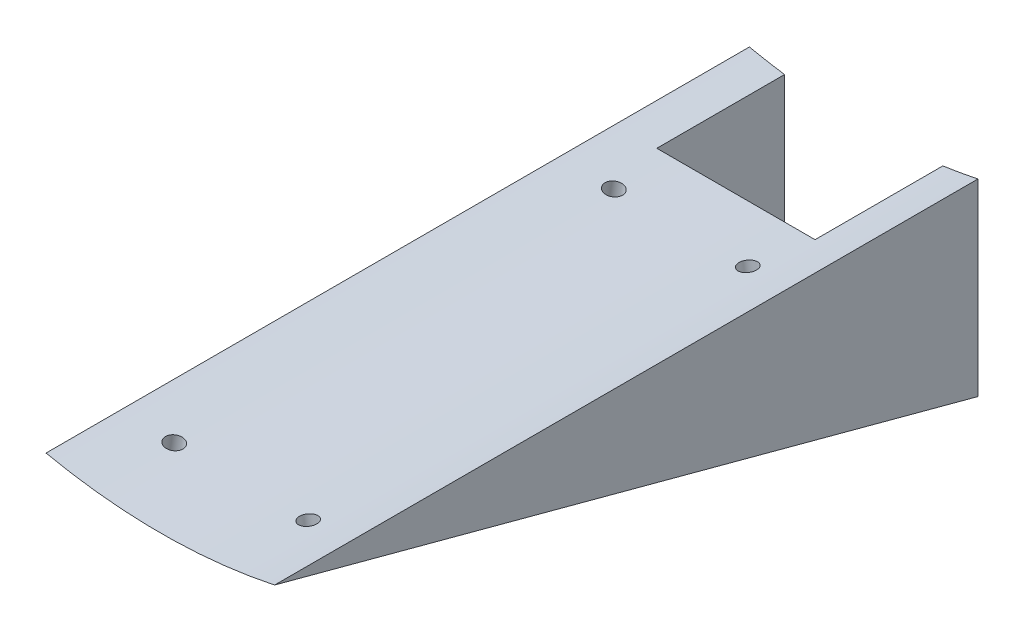
from build123d import *
from build123d.topology import SkipClean

# Parameters (mm, degrees)
BOSS_EXTRUDE1_DEPTH     = 27
BOSS_EXTRUDE2_DEPTH     = 65
CUT_EXTRUDE1_DEPTH      = 91.890043459
FILLET1_R               = 1
BOSS_EXTRUDE3_REACH     = 104.243
CUT_EXTRUDE2_REACH      = 104.243
BOSS_EXTRUDE4_REACH     = 92.026
BOSS_EXTRUDE5_DEPTH     = 65
SKETCH14_R              = 1.5
CUT_EXTRUDE7_DEPTH      = 5
CUT_EXTRUDE9_DEPTH      = 105.630301538
CUT_EXTRUDE9_DEPTH_BACK = 105.630301538
SKETCH15_W              = 45
SKETCH15_H              = 5.74
SKETCH16_R              = 1.5
CUT_EXTRUDE10_DEPTH     = 10
FILLET4_R               = 23
BOSS_EXTRUDE7_REACH     = 219.626
CUT_EXTRUDE5_DEPTH      = 184.620949427
CUT_EXTRUDE5_DEPTH_BACK = 184.620949427
SKETCH11_R              = 2.5
CUT_EXTRUDE6_DEPTH      = 186.847147779
CUT_EXTRUDE6_DEPTH_BACK = 186.847147779
SKETCH12_R              = 2.5
CUT_SWEEP1_START        = -43.471641414
CUT_SWEEP1_DEPTH        = 207.679031883


# Read off the part's stored shape, not the designer's step: Cut-Sweep1
with BuildPart() as part:
    # Sketch1 → Boss-Extrude1 (new body)
    with BuildSketch(Plane.XY):
        with BuildLine():
            Line((0, 0), (0, -26))
            ThreePointArc((0, -26), (32.5, -29.41402025), (65, -26))
            Line((65, -26), (65, 0))
            ThreePointArc((65, 0), (32.5, -3.41402025), (0, 0))
        make_face()
    extrude(amount=BOSS_EXTRUDE1_DEPTH)

    # Sketch4 → Boss-Extrude2 (add)
    with BuildSketch(Plane(origin=(65, 0, 0), x_dir=(0, 0, -1), z_dir=(1, 0, 0))):
        Polygon((0, -26), (30, -56), (30, -30), (0, 0), align=None)
    extrude(amount=-BOSS_EXTRUDE2_DEPTH)

    # Sketch5 → Cut-Extrude1 (cut, through all)
    with BuildSketch(Plane.XY):
        with BuildLine():
            Line((65, 0), (0, 0))
            ThreePointArc((0, 0), (32.5, -3.41402025), (65, 0))
        make_face()
    extrude(amount=-CUT_EXTRUDE1_DEPTH, mode=Mode.SUBTRACT)

    # Fillet1
    fillet1_edges = [part.edges().sort_by_distance(p)[0] for p in [
        (32.5, -56, -30),
    ]]
    fillet(fillet1_edges, radius=FILLET1_R)

    # Boss-Extrude3: up to this face of the body (flat: up to its plane)
    boss_extrude3_end = Plane(part.part.faces().sort_by_distance((32.5, -41.792893219, -30))[0])
    # Sketch6 → Boss-Extrude3 (add, up to the picked face)
    with BuildSketch(Plane.XY.offset(27), mode=Mode.PRIVATE) as boss_extrude3_sk1:
        with BuildLine():
            ThreePointArc((0, -26), (4.985486693, -26.974767058), (10, -27.787112227))
            Line((10, -27.787112227), (10, -1.787112227))
            ThreePointArc((10, -1.787112227), (4.985486693, -0.974767058), (0, 0))
            Line((0, 0), (0, -26))
        make_face()
    boss_extrude3_tool1 = split(extrude(boss_extrude3_sk1.sketch, amount=-BOSS_EXTRUDE3_REACH, mode=Mode.PRIVATE), bisect_by=boss_extrude3_end, keep=Keep.BOTH, mode=Mode.PRIVATE)
    # Sketch6 → Boss-Extrude3 (add, up to the picked face)
    with BuildSketch(Plane.XY.offset(27), mode=Mode.PRIVATE) as boss_extrude3_sk2:
        with BuildLine():
            Line((55, -1.787112227), (55, -27.787112227))
            ThreePointArc((55, -27.787112227), (60.014513307, -26.974767058), (65, -26))
            Line((65, -26), (65, 0))
            ThreePointArc((65, 0), (60.014513307, -0.974767058), (55, -1.787112227))
        make_face()
    boss_extrude3_tool2 = split(extrude(boss_extrude3_sk2.sketch, amount=-BOSS_EXTRUDE3_REACH, mode=Mode.PRIVATE), bisect_by=boss_extrude3_end, keep=Keep.BOTH, mode=Mode.PRIVATE)
    # Sketch6 → Boss-Extrude3 (add, up to the picked face)
    with BuildSketch(Plane.XY.offset(27), mode=Mode.PRIVATE) as boss_extrude3_sk3:
        with BuildLine():
            Line((10, -54.292893219), (10, -27.787112227))
            ThreePointArc((10, -27.787112227), (4.985486693, -26.974767058), (0, -26))
            Line((0, -26), (0, -54.292893219))
            Line((0, -54.292893219), (10, -54.292893219))
        make_face()
    boss_extrude3_tool3 = split(extrude(boss_extrude3_sk3.sketch, amount=-BOSS_EXTRUDE3_REACH, mode=Mode.PRIVATE), bisect_by=boss_extrude3_end, keep=Keep.BOTH, mode=Mode.PRIVATE)
    # Sketch6 → Boss-Extrude3 (add, up to the picked face)
    with BuildSketch(Plane.XY.offset(27), mode=Mode.PRIVATE) as boss_extrude3_sk4:
        with BuildLine():
            ThreePointArc((65, -26), (60.014513307, -26.974767058), (55, -27.787112227))
            Line((55, -27.787112227), (55, -54.292893219))
            Line((55, -54.292893219), (65, -54.292893219))
            Line((65, -54.292893219), (65, -26))
        make_face()
    boss_extrude3_tool4 = split(extrude(boss_extrude3_sk4.sketch, amount=-BOSS_EXTRUDE3_REACH, mode=Mode.PRIVATE), bisect_by=boss_extrude3_end, keep=Keep.BOTH, mode=Mode.PRIVATE)
    add(boss_extrude3_tool1.solids().sort_by(Axis((5, -13.949429, 27), (0, 0, -1)))[0])
    add(boss_extrude3_tool2.solids().sort_by(Axis((60, -13.949429, 27), (0, 0, -1)))[0])
    add(boss_extrude3_tool3.solids().sort_by(Axis((4.945547, -40.616285, 27), (0, 0, -1)))[0])
    add(boss_extrude3_tool4.solids().sort_by(Axis((60.054453, -40.616285, 27), (0, 0, -1)))[0])

    # Cut-Extrude2: up to this plane
    cut_extrude2_end = Plane(origin=(-63.529520697, -13, 13), z_dir=(0, -0.7071067811865562, 0.7071067811865389))
    # Sketch7 → Cut-Extrude2 (cut, up to the surface)
    with BuildSketch(Plane.XY.offset(27), mode=Mode.PRIVATE) as cut_extrude2_sk1:
        with BuildLine():
            ThreePointArc((10, -27.787112227), (4.985486693, -26.974767058), (0, -26))
            Line((0, -26), (0, -54.292893219))
            Line((0, -54.292893219), (10, -54.292893219))
            Line((10, -54.292893219), (10, -27.787112227))
        make_face()
    cut_extrude2_tool1 = split(extrude(cut_extrude2_sk1.sketch, amount=-CUT_EXTRUDE2_REACH, mode=Mode.PRIVATE), bisect_by=cut_extrude2_end, keep=Keep.BOTH, mode=Mode.PRIVATE)
    add(cut_extrude2_tool1.solids().sort_by_distance((4.945547, -40.616285, 27))[0], mode=Mode.SUBTRACT)
    # Sketch7 → Cut-Extrude2 (cut, up to the surface)
    with BuildSketch(Plane.XY.offset(27), mode=Mode.PRIVATE) as cut_extrude2_sk2:
        with BuildLine():
            Line((65, -54.292893219), (65, -26))
            ThreePointArc((65, -26), (60.014513307, -26.974767058), (55, -27.787112227))
            Line((55, -27.787112227), (55, -54.292893219))
            Line((55, -54.292893219), (65, -54.292893219))
        make_face()
    cut_extrude2_tool2 = split(extrude(cut_extrude2_sk2.sketch, amount=-CUT_EXTRUDE2_REACH, mode=Mode.PRIVATE), bisect_by=cut_extrude2_end, keep=Keep.BOTH, mode=Mode.PRIVATE)
    add(cut_extrude2_tool2.solids().sort_by_distance((60.054453, -40.616285, 27))[0], mode=Mode.SUBTRACT)

    # Boss-Extrude4: up to this face of the body (flat: up to its plane)
    boss_extrude4_end = Plane(part.part.faces().sort_by_distance((32.5, -40.28761869, -14.28761869))[0])
    # Sketch8 → Boss-Extrude4 (add, up to the picked face)
    with BuildSketch(Plane(origin=(0, 0, 0), x_dir=(-1, 0, 0), z_dir=(0, 0, -1)), mode=Mode.PRIVATE) as boss_extrude4_sk1:
        with BuildLine():
            Line((-55, -26), (-55, -27.787112227))
            ThreePointArc((-55, -27.787112227), (-32.5, -29.41402025), (-10, -27.787112227))
            Line((-10, -27.787112227), (-10, -26))
            Line((-10, -26), (-55, -26))
        make_face()
    boss_extrude4_tool1 = split(extrude(boss_extrude4_sk1.sketch, amount=BOSS_EXTRUDE4_REACH, mode=Mode.PRIVATE), bisect_by=boss_extrude4_end, keep=Keep.BOTH, mode=Mode.PRIVATE)
    add(boss_extrude4_tool1.solids().sort_by(Axis((32.5, -27.477312, 0), (0, 0, -1)))[0])

    # Sketch9 → Boss-Extrude5 (add)
    with BuildSketch(Plane.ZY):
        Polygon((-30, -51), (-25, -51), (-30, -56), align=None)
    extrude(amount=-BOSS_EXTRUDE5_DEPTH)

    # Sketch14 → Cut-Extrude7 (cut)
    with SkipClean():  # the faces are left unmerged after this step: merging them gives an invalid solid
        with BuildSketch(Plane(origin=(0, 0, 0), x_dir=(1, 0, 0), z_dir=(0, 0.7071067811865561, -0.7071067811865389))):
            with Locations(Location((14, 35.887280306, 0), (0, 0, 270))):
                Circle(SKETCH14_R)
            with Locations(Location((51, 35.887280306, 0), (0, 0, 270))):
                Circle(SKETCH14_R)
            with Locations(Location((51, 11.367280306, 0), (0, 0, 90))):
                Circle(SKETCH14_R)
            with Locations(Location((14, 11.367280306, 0), (0, 0, 90))):
                Circle(SKETCH14_R)
        extrude(amount=-CUT_EXTRUDE7_DEPTH, mode=Mode.SUBTRACT)

    # Sketch15 → Cut-Extrude9 (cut, two sides: drawn at the far end of the back side and taken through both)
    with SkipClean():  # the faces are left unmerged after this step: merging them gives an invalid solid
        with BuildSketch(Plane(origin=(0, 13.5, 13.5), x_dir=(-1, 0, 0), z_dir=(0, -0.7071067811865389, -0.7071067811865561)).offset(-CUT_EXTRUDE9_DEPTH_BACK)):
            with Locations((-32.5, -2.87)):
                Rectangle(SKETCH15_W, SKETCH15_H)
        extrude(amount=CUT_EXTRUDE9_DEPTH + CUT_EXTRUDE9_DEPTH_BACK, mode=Mode.SUBTRACT)

    # Sketch16 → Cut-Extrude10 (cut)
    with SkipClean():  # the faces are left unmerged after this step: merging them gives an invalid solid
        with BuildSketch(Plane(origin=(0, -4.058792924, 4.058792924), x_dir=(1, 0, 0), z_dir=(0, 0.7071067811865562, -0.7071067811865389))):
            with Locations(Location((14, 35.936406871, 0), (0, 0, 270))):
                Circle(SKETCH16_R)
            with Locations(Location((51, 35.936406871, 0), (0, 0, 270))):
                Circle(SKETCH16_R)
            with Locations(Location((14, 11.409221552, 0), (0, 0, 270))):
                Circle(SKETCH16_R)
            with Locations(Location((51, 11.409221552, 0), (0, 0, 270))):
                Circle(SKETCH16_R)
        extrude(amount=-CUT_EXTRUDE10_DEPTH, mode=Mode.SUBTRACT)

    # Fillet4
    fillet4_edges = [part.edges().sort_by_distance(p)[0] for p in [
        (32.5, -29.41402025, -3.41402025),
    ]]
    fillet(fillet4_edges, radius=FILLET4_R)

    # Boss-Extrude7: up to this face of the body (flat: up to its plane)
    boss_extrude7_end = Plane(part.part.faces().sort_by_distance((32.499999985, -45.563204914, -19.563204914))[0])
    # Sketch24 → Boss-Extrude7 (add, up to the picked face)
    with BuildSketch(Plane.XY.offset(170), mode=Mode.PRIVATE) as boss_extrude7_sk1:
        with BuildLine():
            Line((65, -56), (65, 0))
            ThreePointArc((65, 0), (60.014513307, -0.974767058), (55, -1.787112227))
            ThreePointArc((55, -1.787112227), (32.5, -3.41402025), (10, -1.787112227))
            ThreePointArc((10, -1.787112227), (4.985486693, -0.974767058), (0, 0))
            Line((0, 0), (0, -56))
            Line((0, -56), (65, -56))
        make_face()
    boss_extrude7_tool1 = split(extrude(boss_extrude7_sk1.sketch, amount=-BOSS_EXTRUDE7_REACH, mode=Mode.PRIVATE), bisect_by=boss_extrude7_end, keep=Keep.BOTH, mode=Mode.PRIVATE)
    add(boss_extrude7_tool1.solids().sort_by(Axis((32.5, -29.130902, 170), (0, 0, -1)))[0])

    # Sketch11 → Cut-Extrude5 (cut, two sides: drawn at the far end of the back side and taken through both)
    with BuildSketch(Plane(origin=(5.094217018, -35.042120851, 0), x_dir=(-0.9895977747865052, -0.14386189258312035, 0), z_dir=(-0.14386189258312035, 0.9895977747865053, 0)).offset(-CUT_EXTRUDE5_DEPTH_BACK)):
        with Locations(Location((-50.687468406, 22, 0), (0, 0, 180))):
            Circle(SKETCH11_R)
        with Locations(Location((-50.687468406, 147, 0), (0, 0, 180))):
            Circle(SKETCH11_R)
    extrude(amount=CUT_EXTRUDE5_DEPTH + CUT_EXTRUDE5_DEPTH_BACK, mode=Mode.SUBTRACT)

    # Sketch12 → Cut-Extrude6 (cut, two sides: drawn at the far end of the back side and taken through both)
    with BuildSketch(Plane(origin=(-3.74896115, -25.788369281, 0), x_dir=(0.9895977747865055, -0.14386189258311885, 0), z_dir=(-0.14386189258311885, -0.9895977747865056, 0)).offset(-CUT_EXTRUDE6_DEPTH_BACK)):
        with Locations(Location((13.636386955, 22, 0), (0, 0, 180))):
            Circle(SKETCH12_R)
        with Locations(Location((13.636386955, 147, 0), (0, 0, 180))):
            Circle(SKETCH12_R)
    extrude(amount=CUT_EXTRUDE6_DEPTH + CUT_EXTRUDE6_DEPTH_BACK, mode=Mode.SUBTRACT)

    # Cut-Sweep1 outline → Cut-Sweep1 (cut)
    with BuildSketch(Plane(origin=(0, 0, 0), x_dir=(1, 0, 0), z_dir=(0, 0.2588190451025179, 0.9659258262890691)).offset(CUT_SWEEP1_START)):
        with BuildLine():
            Line((65, -100), (65, -43.999237667))
            add(Edge.make_bspline(
                [(65, -43.999237667), (43.493313707, -48.412390901), (21.506686293, -48.412390901), (0, -43.999237667)],
                knots=[0, 0, 0, 0, 1, 1, 1, 1], degree=3, weights=[1, 0.985447484, 0.985447484, 1]))
            Line((0, -43.999237667), (0, -100))
            Line((0, -100), (65, -100))
        make_face()
    extrude(amount=CUT_SWEEP1_DEPTH, mode=Mode.SUBTRACT)


solid = part.part
